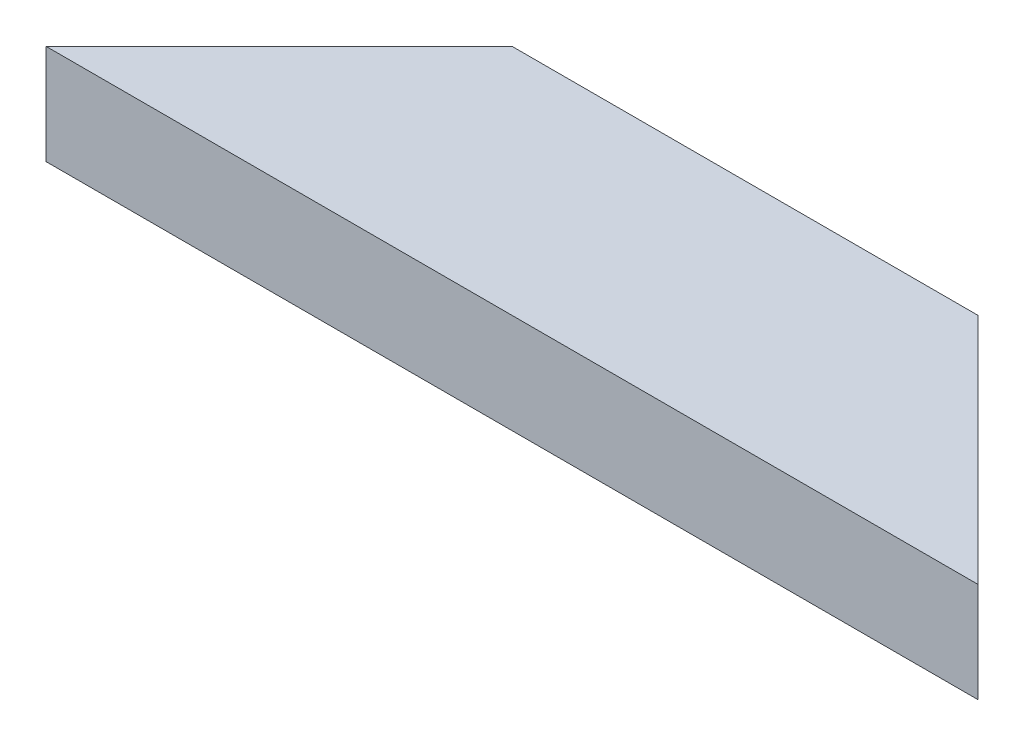
from build123d import *

# Parameters (mm, degrees)
BOSS_EXTRUDE1_DEPTH = 38.1


with BuildPart() as part:
    # Sketch1 → Boss-Extrude1 (new body)
    with BuildSketch(Plane(origin=(0, 0, 0), x_dir=(1, 0, 0), z_dir=(0, 1, 0))):
        Polygon((-106.060551681, 52.978844793), (71.739448319, 52.978844793), (160.639448319, -35.921155207), (-194.960551681, -35.921155207), align=None)
    extrude(amount=BOSS_EXTRUDE1_DEPTH)


solid = part.part
